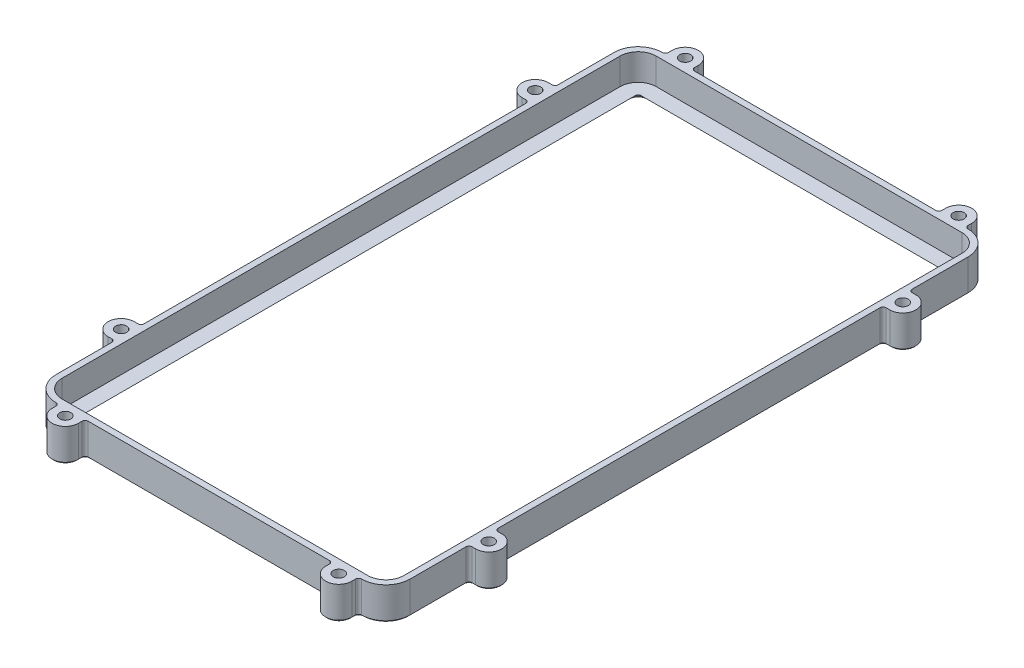
from build123d import *

# Parameters (mm, degrees)
BASE_DEPTH                      = 10.64
SHELL_T                         = -2
CLAMPS_DEPTH                    = 10.64
CLAMP_FILLETS_R                 = 1
FRAME_DEPTH                     = 2
FRAME_CHAMFER_SIZE              = 2
SKETCH23_R                      = 1.8
CLAMP_HOLES_DEPTH               = 192.772268228
SKETCH24_R                      = 2.9
CLAMP_COUNTERSINKS_DEPTH        = 3.4
CLAMP_COUNTERSINK_CHAMFERS_SIZE = 0.3
SHELL_CHAMFER_SIZE              = 0.5


with BuildPart() as part:
    # Sketch19 → Base (new body)
    with BuildSketch(Plane(origin=(0, 0, 0), x_dir=(-1, 0, 0), z_dir=(0, 1, 0))):
        with BuildLine():
            Line((-6.560267788, 45.469362099), (93.039732212, 45.469362099))
            ThreePointArc((93.039732212, 45.469362099), (98.611733648, 43.161363535), (100.919732212, 37.589362099))
            Line((100.919732212, 37.589362099), (100.919732212, -144.210637901))
            ThreePointArc((100.919732212, -144.210637901), (98.611733648, -149.782639336), (93.039732212, -152.090637901))
            Line((93.039732212, -152.090637901), (-6.560267788, -152.090637901))
            ThreePointArc((-6.560267788, -152.090637901), (-12.132269223, -149.782639336), (-14.440267788, -144.210637901))
            Line((-14.440267788, -144.210637901), (-14.440267788, 37.589362099))
            ThreePointArc((-14.440267788, 37.589362099), (-12.132269223, 43.161363535), (-6.560267788, 45.469362099))
        make_face()
    extrude(amount=BASE_DEPTH)

    # Shell
    shell_openings = [part.faces().sort_by_distance(p)[0] for p in [
        (-43.239732212, 10.64, -53.310637901),
        (-43.239732212, 0, -53.310637901),
    ]]
    offset(amount=SHELL_T, openings=shell_openings, kind=Kind.INTERSECTION)

    # Sketch22 → Clamps (add)
    with BuildSketch(Plane(origin=(0, 0, 0), x_dir=(-1, 0, 0), z_dir=(0, -1, 0))):
        with BuildLine():
            Line((-5.560267788, 154.290637901), (-5.560267788, 152.090637901))
            Line((-5.560267788, 152.090637901), (2.939732212, 152.090637901))
            Line((2.939732212, 152.090637901), (2.939732212, 154.290637901))
            ThreePointArc((2.939732212, 154.290637901), (-1.310267788, 158.540637901), (-5.560267788, 154.290637901))
        make_face()
        with BuildLine():
            Line((83.539732212, 154.290637901), (83.539732212, 152.090637901))
            Line((83.539732212, 152.090637901), (92.039732212, 152.090637901))
            Line((92.039732212, 152.090637901), (92.039732212, 154.290637901))
            ThreePointArc((92.039732212, 154.290637901), (87.789732212, 158.540637901), (83.539732212, 154.290637901))
        make_face()
        with BuildLine():
            Line((-5.560267788, -47.669362099), (-5.560267788, -45.469362099))
            Line((-5.560267788, -45.469362099), (2.939732212, -45.469362099))
            Line((2.939732212, -45.469362099), (2.939732212, -47.669362099))
            ThreePointArc((2.939732212, -47.669362099), (-1.310267788, -51.919362099), (-5.560267788, -47.669362099))
        make_face()
        with BuildLine():
            Line((83.539732212, -47.669362099), (83.539732212, -45.469362099))
            Line((83.539732212, -45.469362099), (92.039732212, -45.469362099))
            Line((92.039732212, -45.469362099), (92.039732212, -47.669362099))
            ThreePointArc((92.039732212, -47.669362099), (87.789732212, -51.919362099), (83.539732212, -47.669362099))
        make_face()
        with BuildLine():
            Line((-16.640267788, -18.389362099), (-14.440267788, -18.389362099))
            Line((-14.440267788, -18.389362099), (-14.440267788, -9.889362099))
            Line((-14.440267788, -9.889362099), (-16.640267788, -9.889362099))
            ThreePointArc((-16.640267788, -9.889362099), (-20.890267788, -14.139362099), (-16.640267788, -18.389362099))
        make_face()
        with BuildLine():
            Line((-16.640267788, 116.510637901), (-14.440267788, 116.510637901))
            Line((-14.440267788, 116.510637901), (-14.440267788, 125.010637901))
            Line((-14.440267788, 125.010637901), (-16.640267788, 125.010637901))
            ThreePointArc((-16.640267788, 125.010637901), (-20.890267788, 120.760637901), (-16.640267788, 116.510637901))
        make_face()
        with BuildLine():
            Line((103.119732212, 125.010637901), (100.919732212, 125.010637901))
            Line((100.919732212, 125.010637901), (100.919732212, 116.510637901))
            Line((100.919732212, 116.510637901), (103.119732212, 116.510637901))
            ThreePointArc((103.119732212, 116.510637901), (107.369732212, 120.760637901), (103.119732212, 125.010637901))
        make_face()
        with BuildLine():
            Line((100.919732212, -9.889362099), (103.119732212, -9.889362099))
            ThreePointArc((103.119732212, -9.889362099), (107.369732212, -14.139362099), (103.119732212, -18.389362099))
            Line((103.119732212, -18.389362099), (100.919732212, -18.389362099))
            Line((100.919732212, -18.389362099), (100.919732212, -9.889362099))
        make_face()
    extrude(amount=-CLAMPS_DEPTH)

    # Clamp Fillets
    clamp_fillets_edges = [part.edges().sort_by_distance(p)[0] for p in [
        (14.440267788, 5.32, -116.510637901),
        (14.440267788, 5.32, -125.010637901),
        (-100.919732212, 5.32, -125.010637901),
        (-100.919732212, 5.32, -116.510637901),
        (-100.919732212, 5.32, 9.889362099),
        (-100.919732212, 5.32, 18.389362099),
        (5.560267788, 5.32, -152.090637901),
        (-2.939732212, 5.32, -152.090637901),
        (-83.539732212, 5.32, -152.090637901),
        (-92.039732212, 5.32, -152.090637901),
        (-2.939732212, 5.32, 45.469362099),
        (5.560267788, 5.32, 45.469362099),
        (-92.039732212, 5.32, 45.469362099),
        (-83.539732212, 5.32, 45.469362099),
        (14.440267788, 5.32, 18.389362099),
        (14.440267788, 5.32, 9.889362099),
    ]]
    fillet(clamp_fillets_edges, radius=CLAMP_FILLETS_R - 0.0001)  # a hair under: the kernel refuses the full size

    # Sketch25 → Frame (add)
    with BuildSketch(Plane.XZ):
        with BuildLine():
            Line((14.440267788, -144.210637901), (14.440267788, -126.010637901))
            ThreePointArc((14.440267788, -126.010637901), (14.733161006, -125.303531119), (15.440267788, -125.010637901))
            Line((15.440267788, -125.010637901), (16.640267788, -125.010637901))
            ThreePointArc((16.640267788, -125.010637901), (20.890267788, -120.760637901), (16.640267788, -116.510637901))
            Line((16.640267788, -116.510637901), (15.440267788, -116.510637901))
            ThreePointArc((15.440267788, -116.510637901), (14.733161006, -116.217744682), (14.440267788, -115.510637901))
            Line((14.440267788, -115.510637901), (14.440267788, 8.889362099))
            ThreePointArc((14.440267788, 8.889362099), (14.733161006, 9.596468881), (15.440267788, 9.889362099))
            Line((15.440267788, 9.889362099), (16.640267788, 9.889362099))
            ThreePointArc((16.640267788, 9.889362099), (20.890267788, 14.139362099), (16.640267788, 18.389362099))
            Line((16.640267788, 18.389362099), (15.440267788, 18.389362099))
            ThreePointArc((15.440267788, 18.389362099), (14.733161006, 18.682255318), (14.440267788, 19.389362099))
            Line((14.440267788, 19.389362099), (14.440267788, 37.589362099))
            ThreePointArc((14.440267788, 37.589362099), (12.132269223, 43.161363535), (6.560267788, 45.469362099))
            ThreePointArc((6.560267788, 45.469362099), (5.853161006, 45.762255318), (5.560267788, 46.469362099))
            Line((5.560267788, 46.469362099), (5.560267788, 47.669362099))
            ThreePointArc((5.560267788, 47.669362099), (1.310267788, 51.919362099), (-2.939732212, 47.669362099))
            Line((-2.939732212, 47.669362099), (-2.939732212, 46.469362099))
            ThreePointArc((-2.939732212, 46.469362099), (-3.232625431, 45.762255318), (-3.939732212, 45.469362099))
            Line((-3.939732212, 45.469362099), (-82.539732212, 45.469362099))
            ThreePointArc((-82.539732212, 45.469362099), (-83.246838994, 45.762255318), (-83.539732212, 46.469362099))
            Line((-83.539732212, 46.469362099), (-83.539732212, 47.669362099))
            ThreePointArc((-83.539732212, 47.669362099), (-87.789732212, 51.919362099), (-92.039732212, 47.669362099))
            Line((-92.039732212, 47.669362099), (-92.039732212, 46.469362099))
            ThreePointArc((-92.039732212, 46.469362099), (-92.332625431, 45.762255318), (-93.039732212, 45.469362099))
            ThreePointArc((-93.039732212, 45.469362099), (-98.611733648, 43.161363535), (-100.919732212, 37.589362099))
            Line((-100.919732212, 37.589362099), (-100.919732212, 19.389362099))
            ThreePointArc((-100.919732212, 19.389362099), (-101.212625431, 18.682255318), (-101.919732212, 18.389362099))
            Line((-101.919732212, 18.389362099), (-103.119732212, 18.389362099))
            ThreePointArc((-103.119732212, 18.389362099), (-107.369732212, 14.139362099), (-103.119732212, 9.889362099))
            Line((-103.119732212, 9.889362099), (-101.919732212, 9.889362099))
            ThreePointArc((-101.919732212, 9.889362099), (-101.212625431, 9.596468881), (-100.919732212, 8.889362099))
            Line((-100.919732212, 8.889362099), (-100.919732212, -115.510637901))
            ThreePointArc((-100.919732212, -115.510637901), (-101.212625431, -116.217744682), (-101.919732212, -116.510637901))
            Line((-101.919732212, -116.510637901), (-103.119732212, -116.510637901))
            ThreePointArc((-103.119732212, -116.510637901), (-107.369732212, -120.760637901), (-103.119732212, -125.010637901))
            Line((-103.119732212, -125.010637901), (-101.919732212, -125.010637901))
            ThreePointArc((-101.919732212, -125.010637901), (-101.212625431, -125.303531119), (-100.919732212, -126.010637901))
            Line((-100.919732212, -126.010637901), (-100.919732212, -144.210637901))
            ThreePointArc((-100.919732212, -144.210637901), (-98.611733648, -149.782639336), (-93.039732212, -152.090637901))
            ThreePointArc((-93.039732212, -152.090637901), (-92.332625431, -152.383531119), (-92.039732212, -153.090637901))
            Line((-92.039732212, -153.090637901), (-92.039732212, -154.290637901))
            ThreePointArc((-92.039732212, -154.290637901), (-87.789732212, -158.540637901), (-83.539732212, -154.290637901))
            Line((-83.539732212, -154.290637901), (-83.539732212, -153.090637901))
            ThreePointArc((-83.539732212, -153.090637901), (-83.246838994, -152.383531119), (-82.539732212, -152.090637901))
            Line((-82.539732212, -152.090637901), (-3.939732212, -152.090637901))
            ThreePointArc((-3.939732212, -152.090637901), (-3.232625431, -152.383531119), (-2.939732212, -153.090637901))
            Line((-2.939732212, -153.090637901), (-2.939732212, -154.290637901))
            ThreePointArc((-2.939732212, -154.290637901), (1.310267788, -158.540637901), (5.560267788, -154.290637901))
            Line((5.560267788, -154.290637901), (5.560267788, -153.090637901))
            ThreePointArc((5.560267788, -153.090637901), (5.853161006, -152.383531119), (6.560267788, -152.090637901))
            ThreePointArc((6.560267788, -152.090637901), (12.132269223, -149.782639336), (14.440267788, -144.210637901))
        make_face()
        with BuildLine():
            Line((6.560267788, 38.469362099), (-93.039732212, 38.469362099))
            ThreePointArc((-93.039732212, 38.469362099), (-93.66198618, 38.211616067), (-93.919732212, 37.589362099))
            Line((-93.919732212, 37.589362099), (-93.919732212, -144.210637901))
            ThreePointArc((-93.919732212, -144.210637901), (-93.66198618, -144.832891868), (-93.039732212, -145.090637901))
            Line((-93.039732212, -145.090637901), (6.560267788, -145.090637901))
            ThreePointArc((6.560267788, -145.090637901), (7.182521755, -144.832891868), (7.440267788, -144.210637901))
            Line((7.440267788, -144.210637901), (7.440267788, 37.589362099))
            ThreePointArc((7.440267788, 37.589362099), (7.182521755, 38.211616067), (6.560267788, 38.469362099))
        make_face(mode=Mode.SUBTRACT)
    extrude(amount=-FRAME_DEPTH)

    # Frame Chamfer
    frame_chamfer_edges = [part.edges().sort_by_distance(p)[0] for p in [
        (-43.239732212, 0, 38.469362099),
        (7.440267788, 0, -53.310637901),
        (-43.239732212, 0, -145.090637901),
        (-93.919732212, 0, -53.310637901),
        (7.182521755, 0, 38.211616067),
        (7.182521755, 0, -144.832891868),
        (-93.66198618, 0, 38.211616067),
        (-93.66198618, 0, -144.832891868),
    ]]
    chamfer(frame_chamfer_edges, length=FRAME_CHAMFER_SIZE - 0.0001)  # a hair under: the kernel refuses the full size

    # Sketch23 → Clamp Holes (cut, through all)
    with BuildSketch(Plane(origin=(0, 0, 0), x_dir=(-1, 0, 0), z_dir=(0, -1, 0))):
        with Locations(Location((-1.310267788, 154.290637901, 0), (0, 0, 90))):
            Circle(SKETCH23_R)
        with Locations(Location((87.789732212, 154.290637901, 0), (0, 0, 90))):
            Circle(SKETCH23_R)
        with Locations(Location((-1.310267788, -47.669362099, 0), (0, 0, 90))):
            Circle(SKETCH23_R)
        with Locations(Location((87.789732212, -47.669362099, 0), (0, 0, 90))):
            Circle(SKETCH23_R)
        with Locations(Location((-16.640267788, 120.760637901, 0), (0, 0, 90))):
            Circle(SKETCH23_R)
        with Locations(Location((103.119732212, 120.760637901, 0), (0, 0, 90))):
            Circle(SKETCH23_R)
        with Locations(Location((103.119732212, -14.139362099, 0), (0, 0, 90))):
            Circle(SKETCH23_R)
        with Locations(Location((-16.640267788, -14.139362099, 0), (0, 0, 90))):
            Circle(SKETCH23_R)
    extrude(amount=-CLAMP_HOLES_DEPTH, mode=Mode.SUBTRACT)

    # Sketch24 → Clamp Countersinks (cut)
    with BuildSketch(Plane.XZ):
        with Locations(Location((-87.789732212, 47.669362099, 0), (0, 0, 270))):
            Circle(SKETCH24_R)
        with Locations(Location((1.310267788, 47.669362099, 0), (0, 0, 270))):
            Circle(SKETCH24_R)
        with Locations(Location((1.310267788, -154.290637901, 0), (0, 0, 270))):
            Circle(SKETCH24_R)
        with Locations(Location((-87.789732212, -154.290637901, 0), (0, 0, 270))):
            Circle(SKETCH24_R)
        with Locations(Location((16.640267788, -120.760637901, 0), (0, 0, 270))):
            Circle(SKETCH24_R)
        with Locations(Location((-103.119732212, -120.760637901, 0), (0, 0, 270))):
            Circle(SKETCH24_R)
        with Locations(Location((-103.119732212, 14.139362099, 0), (0, 0, 270))):
            Circle(SKETCH24_R)
        with Locations(Location((16.640267788, 14.139362099, 0), (0, 0, 270))):
            Circle(SKETCH24_R)
    extrude(amount=-CLAMP_COUNTERSINKS_DEPTH, mode=Mode.SUBTRACT)

    # Clamp Countersink Chamfers
    clamp_countersink_chamfers_edges = [part.edges().sort_by_distance(p)[0] for p in [
        (-87.789732212, 0, -151.390637901),
        (1.310267788, 0, -151.390637901),
        (1.310267788, 0, 50.569362099),
        (-87.789732212, 0, 50.569362099),
    ]]
    chamfer(clamp_countersink_chamfers_edges, length=CLAMP_COUNTERSINK_CHAMFERS_SIZE)

    # Shell Chamfer
    shell_chamfer_edges = [part.edges().sort_by_distance(p)[0] for p in [
        (20.890267788, 0, -120.760637901),
        (16.040217788, 0, -116.510637901),
        (12.132269223, 0, -149.782639336),
        (-107.369732212, 0, -120.760637901),
        (-102.519682212, 0, -125.010637901),
        (-107.369732212, 0, 14.139362099),
        (-102.519682212, 0, 9.889362099),
        (-100.919732212, 0, 28.489312099),
        (-102.519682212, 0, 18.389362099),
        (-100.919732212, 0, -53.310637901),
        (-102.519682212, 0, -116.510637901),
        (14.440267788, 0, -135.110587901),
        (16.040217788, 0, -125.010637901),
        (14.440267788, 0, -53.310637901),
        (16.040217788, 0, 9.889362099),
        (-43.239732212, 0, 45.469362099),
        (-83.539732212, 0, 47.069312099),
        (5.560267788, 0, 47.069312099),
        (-43.239732212, 0, -152.090637901),
        (-2.939732212, 0, -153.690587901),
        (-92.039732212, 0, -153.690587901),
        (-101.212625431, 0, 18.682255318),
        (-101.212625431, 0, -116.217744682),
        (-101.212625431, 0, -125.303531119),
        (-101.212625431, 0, 9.596468881),
        (14.733161006, 0, -125.303531119),
        (14.733161006, 0, 9.596468881),
        (14.733161006, 0, -116.217744682),
        (14.733161006, 0, 18.682255318),
        (-83.246838994, 0, 45.762255318),
        (5.853161006, 0, 45.762255318),
        (-3.232625431, 0, 45.762255318),
        (-92.332625431, 0, 45.762255318),
        (-3.232625431, 0, -152.383531119),
        (-92.332625431, 0, -152.383531119),
        (-83.246838994, 0, -152.383531119),
        (5.853161006, 0, -152.383531119),
        (1.310267788, 0, -158.540637901),
        (5.560267788, 0, -153.690587901),
        (-87.789732212, 0, -158.540637901),
        (-83.539732212, 0, -153.690587901),
        (1.310267788, 0, 51.919362099),
        (-2.939732212, 0, 47.069312099),
        (14.440267788, 0, 28.489312099),
        (12.132269223, 0, 43.161363535),
        (-87.789732212, 0, 51.919362099),
        (-92.039732212, 0, 47.069312099),
        (-98.611733648, 0, 43.161363535),
        (20.890267788, 0, 14.139362099),
        (16.040217788, 0, 18.389362099),
        (-100.919732212, 0, -135.110587901),
        (-98.611733648, 0, -149.782639336),
    ]]
    chamfer(shell_chamfer_edges, length=SHELL_CHAMFER_SIZE)


solid = part.part
